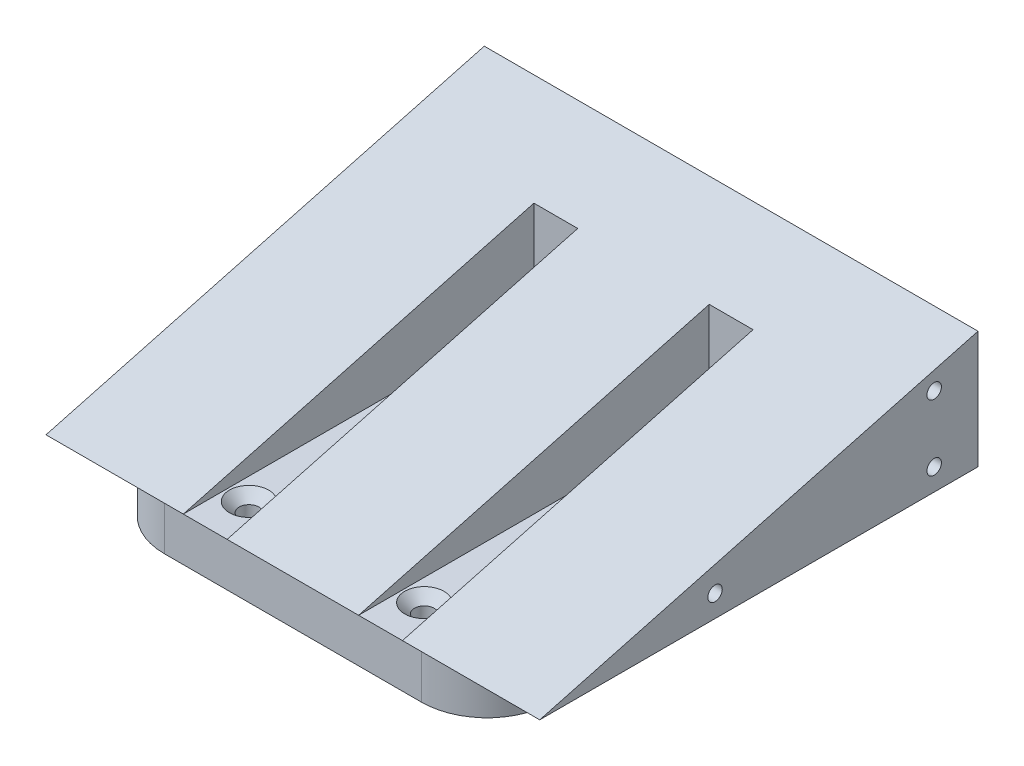
from build123d import *

# Parameters (mm, degrees)
BOSS_EXTRUDE1_DEPTH            = 112.65
M4X0_7_TAPPED_HOLE1_AT_2_COUNT = 2
M4X0_7_TAPPED_HOLE1_AT_2_PITCH = 50
M4X0_7_TAPPED_HOLE1_AT_3_COUNT = 2
M4X0_7_TAPPED_HOLE1_AT_3_PITCH = 52.201532545
SKETCH7_W                      = 10
SKETCH7_H                      = 54.452673799
CUT_EXTRUDE2_DEPTH             = 80
CSK_FOR_M4_SFHCS1_AT_2_COUNT   = 2
CSK_FOR_M4_SFHCS1_AT_2_PITCH   = 60
SKETCH11_W                     = 12
SKETCH11_H                     = 10
CUT_EXTRUDE3_DEPTH             = 156.060918939
FILLET1_R                      = 15


with BuildPart() as part:
    # Sketch1 → Boss-Extrude1 (new body)
    with BuildSketch(Plane(origin=(0, 0, 0), x_dir=(0, 0, -1), z_dir=(1, 0, 0))):
        Polygon((-50, 10), (-50, 0), (50, 0), (50, 36.794919243), align=None)
    extrude(amount=BOSS_EXTRUDE1_DEPTH)

    # Sketch5 → M4x0.7 Tapped Hole1 (revolve, cut)
    with BuildSketch(Plane(origin=(112.65, 15, 10), x_dir=(0, 0, -1), z_dir=(0, 1, 0))):
        Polygon((0, 0), (0, 11.091420021), (1.65, 10.1), (1.65, 0), align=None)
    m4x0_7_tapped_hole1 = revolve(axis=Axis((119, 15, 10), (-1, 0, 0)), mode=Mode.SUBTRACT)

    # M4x0.7 Tapped Hole1 at 2: M4x0.7 Tapped Hole1 ×2
    with Locations(*[(0, 0, -i * M4X0_7_TAPPED_HOLE1_AT_2_PITCH) for i in range(1, M4X0_7_TAPPED_HOLE1_AT_2_COUNT)]):
        add(m4x0_7_tapped_hole1, mode=Mode.SUBTRACT)

    # M4x0.7 Tapped Hole1 at 3: M4x0.7 Tapped Hole1 ×2
    with Locations(*[Vector(0, 0.28734788556634544, -0.9578262852211514) * (i * M4X0_7_TAPPED_HOLE1_AT_3_PITCH) for i in range(1, M4X0_7_TAPPED_HOLE1_AT_3_COUNT)]):
        add(m4x0_7_tapped_hole1, mode=Mode.SUBTRACT)

    # Sketch7 → Cut-Extrude2 (cut)
    with BuildSketch(Plane.XY.offset(50)):
        with Locations((76.325, 37.2263369)):
            Rectangle(SKETCH7_W, SKETCH7_H)
    cut_extrude2 = extrude(amount=-CUT_EXTRUDE2_DEPTH, mode=Mode.SUBTRACT)

    # Sketch10 → CSK for M4 SFHCS1 (revolve, cut)
    with BuildSketch(Plane(origin=(76.325, 10, -20), x_dir=(0, 0, 1), z_dir=(1, 0, 0))):
        Polygon((0, 0), (0, 11.451936393), (2.25, 10.1), (2.25, 2.23), (4.48, 0), align=None)
    csk_for_m4_sfhcs1 = revolve(axis=Axis((76.325, 16.35, -20), (0, -1, 0)), mode=Mode.SUBTRACT)

    # CSK for M4 SFHCS1 at 2: CSK for M4 SFHCS1 ×2
    with Locations(*[(0, 0, i * CSK_FOR_M4_SFHCS1_AT_2_PITCH) for i in range(1, CSK_FOR_M4_SFHCS1_AT_2_COUNT)]):
        add(csk_for_m4_sfhcs1, mode=Mode.SUBTRACT)

    # Sketch11 → Cut-Extrude3 (cut, through all)
    with BuildSketch(Plane.XY.offset(50)):
        with Locations((106.65, 5)):
            Rectangle(SKETCH11_W, SKETCH11_H)
    cut_extrude3 = extrude(amount=-CUT_EXTRUDE3_DEPTH, mode=Mode.SUBTRACT)

    # Mirror1: M4x0.7 Tapped Hole1, Cut-Extrude2, CSK for M4 SFHCS1, Cut-Extrude3 across plane
    add(m4x0_7_tapped_hole1.mirror(Plane.ZY.offset(-56.325)), mode=Mode.SUBTRACT)
    add(cut_extrude2.mirror(Plane.ZY.offset(-56.325)), mode=Mode.SUBTRACT)
    add(csk_for_m4_sfhcs1.mirror(Plane.ZY.offset(-56.325)), mode=Mode.SUBTRACT)
    add(cut_extrude3.mirror(Plane.ZY.offset(-56.325)), mode=Mode.SUBTRACT)

    # Mirror1 copy 1 sketch → Mirror1 copy 1 (revolve, cut)
    with BuildSketch(Plane(origin=(0, 15, -40), x_dir=(0, 0, -1), z_dir=(0, 1, 0))):
        Polygon((0, 0), (0, -11.091420021), (1.65, -10.1), (1.65, 0), align=None)
    revolve(axis=Axis((-6.35, 15, -40), (-1, 0, 0)), mode=Mode.SUBTRACT)

    # Mirror1 copy 2 sketch → Mirror1 copy 2 (revolve, cut)
    with BuildSketch(Plane(origin=(0, 30, -40), x_dir=(0, 0, -1), z_dir=(0, 1, 0))):
        Polygon((0, 0), (0, -11.091420021), (1.65, -10.1), (1.65, 0), align=None)
    revolve(axis=Axis((-6.35, 30, -40), (-1, 0, 0)), mode=Mode.SUBTRACT)

    # Mirror1 copy 3 sketch → Mirror1 copy 3 (revolve, cut)
    with BuildSketch(Plane(origin=(36.325, 10, 40), x_dir=(0, 0, 1), z_dir=(-1, 0, 0))):
        Polygon((0, 0), (0, -11.451936393), (2.25, -10.1), (2.25, -2.23), (4.48, 0), align=None)
    revolve(axis=Axis((36.325, 16.35, 40), (0, 1, 0)), mode=Mode.SUBTRACT)

    # Fillet1
    fillet1_edges = [part.edges().sort_by_distance(p)[0] for p in [
        (100.65, 5, 50),
        (100.65, 5, -50),
        (12, 5, -50),
        (12, 5, 50),
    ]]
    fillet(fillet1_edges, radius=FILLET1_R)


solid = part.part
